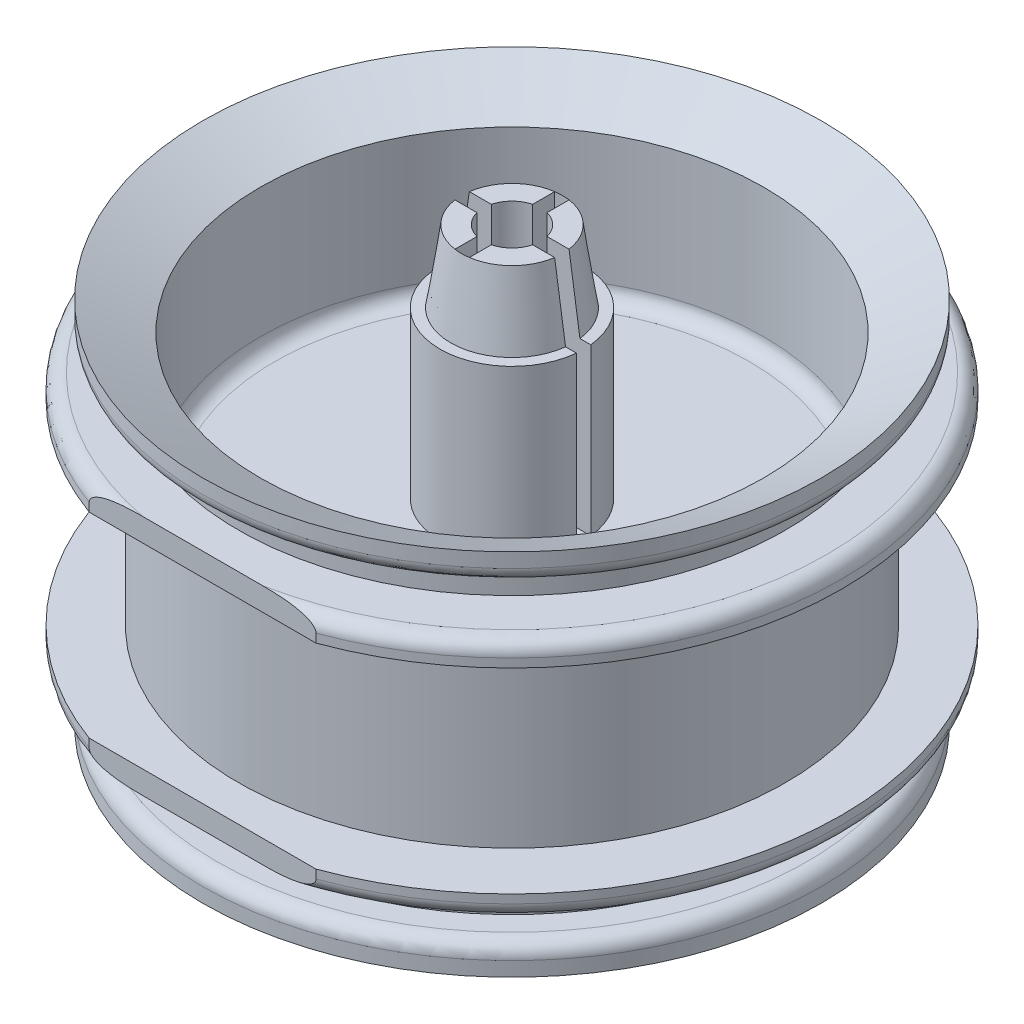
from build123d import *
from build123d.topology import SkipClean

# Parameters (mm, degrees)
SKETCH_1_R          = 19
EXTRUDE_1_DEPTH     = 25.6
SKETCH_6_R          = 17.5
CUT_EXTRUDE_1_DEPTH = 12
CUT_EXTRUDE_START   = -12
SKETCH_7_R          = 17.5
CUT_EXTRUDE_2_DEPTH = 12
SKETCH_9_R          = 3.5
EXTRUDE_2_DEPTH     = 2
SKETCH_10_R         = 5
EXTRUDE_3_DEPTH     = 11.5
CUT_EXTRUDE_3_DEPTH = 16.5
CUT_EXTRUDE_4_REACH = 46.213
SKETCH_13_W         = 10
SKETCH_13_H         = 1
CUT_EXTRUDE_START_2 = -3
SKETCH_14_R         = 2
CUT_EXTRUDE_5_DEPTH = 36.116007136
CUT_EXTRUDE_6_DEPTH = 3
CUT_EXTRUDE_START_3 = 21.5
SKETCH_16_W         = 48.533452519
SKETCH_16_H         = 19.302023182
CUT_EXTRUDE_7_DEPTH = 1.4
CUT_EXTRUDE_START_4 = -22.9
SKETCH_16_2_W       = 48.533452519
SKETCH_16_2_H       = 19.302023182
CUT_EXTRUDE_8_DEPTH = 1.4
SKETCH_17_R         = 2
CUT_EXTRUDE_9_DEPTH = 0.5
CHAMFER_1_SIZE      = 0.5
FILLET_1_R          = 1


# Read off the part's stored shape, not the designer's step: 切除-拉伸6
with BuildPart() as part:
    # 草图1 → 凸台-拉伸1 (new body)
    with BuildSketch(Plane(origin=(0, 0, 0), x_dir=(1, 0, 0), z_dir=(0, 1, 0))):
        with Locations(Location((0, 0, 0), (0, 0, 270))):
            Circle(SKETCH_1_R)
    extrude(amount=EXTRUDE_1_DEPTH)

    # 草图4 → 旋转1 (revolve)
    with BuildSketch(Plane.XY, mode=Mode.PRIVATE) as revolve_1_sk:
        with BuildLine():
            Line((21.5, 25.6), (21.5, 24.6))
            ThreePointArc((21.5, 24.6), (21.207106781, 23.892893219), (20.5, 23.6))
            Line((20.5, 23.6), (19, 23.6))
            Line((19, 23.6), (19, 25.6))
            Line((19, 25.6), (21.5, 25.6))
        make_face()
        with BuildLine():
            Line((21.5, 0), (21.5, 1))
            ThreePointArc((21.5, 1), (21.207106781, 1.707106781), (20.5, 2))
            Line((20.5, 2), (19, 2))
            Line((19, 2), (19, 0))
            Line((19, 0), (21.5, 0))
        make_face()
    revolve(revolve_1_sk.sketch.rotate(Axis((0, 0, 0), (0, 1, 0)), 90), axis=Axis((0, 0, 0), (0, 1, 0)))

    # 草图5 → 旋转2 (revolve)
    with BuildSketch(Plane.XY, mode=Mode.PRIVATE) as revolve_2_sk:
        with BuildLine():
            Line((22.9, 19.6), (22.9, 20.2))
            ThreePointArc((22.9, 20.2), (22.607106781, 20.907106781), (21.9, 21.2))
            Line((21.9, 21.2), (19, 21.2))
            Line((19, 21.2), (19, 19.6))
            Line((19, 19.6), (22.9, 19.6))
        make_face()
        with BuildLine():
            Line((19, 4.4), (19, 6))
            Line((19, 6), (22.9, 6))
            Line((22.9, 6), (22.9, 5.4))
            ThreePointArc((22.9, 5.4), (22.607106781, 4.692893219), (21.9, 4.4))
            Line((21.9, 4.4), (19, 4.4))
        make_face()
    revolve(revolve_2_sk.sketch.rotate(Axis((0, 0, 0), (0, 1, 0)), 90), axis=Axis((0, 0, 0), (0, 1, 0)))

    # 草图6 → 切除-拉伸1 (cut)
    with BuildSketch(Plane(origin=(0, 25.6, 0), x_dir=(1, 0, 0), z_dir=(0, 1, 0))):
        with Locations(Location((0, 0, 0), (0, 0, 270))):
            Circle(SKETCH_6_R)
    extrude(amount=-CUT_EXTRUDE_1_DEPTH, mode=Mode.SUBTRACT)

    # 草图7 → 切除-拉伸2 (cut)
    with BuildSketch(Plane.XZ.offset(CUT_EXTRUDE_START)):
        with Locations(Location((0, 0, 0), (0, 0, 90))):
            Circle(SKETCH_7_R)
    extrude(amount=CUT_EXTRUDE_2_DEPTH, mode=Mode.SUBTRACT)

    # 草图8 → 切除-旋转1 (revolve, cut)
    with BuildSketch(Plane.XY, mode=Mode.PRIVATE) as cut_revolve_1_sk:
        Polygon((0, 25.6), (0, 23.6), (17.5, 23.6), (21.5, 25.6), align=None)
        Polygon((17.5, 2), (21.5, 0), (0, 0), (0, 2), align=None)
    revolve(cut_revolve_1_sk.sketch.rotate(Axis((0, 0, 0), (0, 1, 0)), 90), axis=Axis((0, 0, 0), (0, 1, 0)), mode=Mode.SUBTRACT)

    # 草图9 → 凸台-拉伸2 (add)
    with BuildSketch(Plane(origin=(0, 12, 0), x_dir=(-1, 0, 0), z_dir=(0, -1, 0))):
        with Locations(Location((0, 0, 0), (0, 0, 90))):
            Circle(SKETCH_9_R)
    extrude(amount=EXTRUDE_2_DEPTH)

    # 草图10 → 凸台-拉伸3 (add)
    with BuildSketch(Plane(origin=(0, 13.6, 0), x_dir=(1, 0, 0), z_dir=(0, 1, 0))):
        with Locations(Location((0, 0, 0), (0, 0, 270))):
            Circle(SKETCH_10_R)
    extrude(amount=EXTRUDE_3_DEPTH)

    # 草图11 → 旋转3 (revolve)
    with BuildSketch(Plane.XY, mode=Mode.PRIVATE) as revolve_3_sk:
        Polygon((4.25, 25.1), (3.5, 30.1), (0, 30.1), (0, 25.1), align=None)
    revolve(revolve_3_sk.sketch.rotate(Axis((0, 30.1, 0), (0, -1, 0)), 270), axis=Axis((0, 30.1, 0), (0, -1, 0)))

    # 草图12 → 切除-拉伸3 (cut)
    with BuildSketch(Plane(origin=(0, 30.1, 0), x_dir=(1, 0, 0), z_dir=(0, 1, 0))):
        with BuildLine():
            Line((-0.5, -1.936491673), (-0.5, -3.464101615))
            ThreePointArc((-0.5, -3.464101615), (0, -3.5), (0.5, -3.464101615))
            Line((0.5, -3.464101615), (0.5, -1.936491673))
            ThreePointArc((0.5, -1.936491673), (2, 0), (0.5, 1.936491673))
            Line((0.5, 1.936491673), (0.5, 3.464101615))
            ThreePointArc((0.5, 3.464101615), (0, 3.5), (-0.5, 3.464101615))
            Line((-0.5, 3.464101615), (-0.5, 1.936491673))
            ThreePointArc((-0.5, 1.936491673), (-2, 0), (-0.5, -1.936491673))
        make_face()
    extrude(amount=-CUT_EXTRUDE_3_DEPTH, mode=Mode.SUBTRACT)

    # 切除-拉伸4: up to this face of the body (flat: up to its plane)
    cut_extrude_4_end = Plane(part.part.faces().sort_by_distance((0, 13.6, -17.005025253))[0])
    # 草图13 → 切除-拉伸4 (cut, up to the picked face)
    with BuildSketch(Plane(origin=(0, 30.1, 0), x_dir=(1, 0, 0), z_dir=(0, 1, 0)), mode=Mode.PRIVATE) as cut_extrude_4_sk1:
        Rectangle(SKETCH_13_W, SKETCH_13_H)
    cut_extrude_4_tool1 = split(extrude(cut_extrude_4_sk1.sketch, amount=-CUT_EXTRUDE_4_REACH, mode=Mode.PRIVATE), bisect_by=cut_extrude_4_end, keep=Keep.BOTH, mode=Mode.PRIVATE)
    add(cut_extrude_4_tool1.solids().sort_by(Axis((0, 30.1, 0), (0, -1, 0)))[0], mode=Mode.SUBTRACT)

    # 草图14 → 切除-拉伸5 (cut, through all)
    with BuildSketch(Plane(origin=(0, 10, 0), x_dir=(-1, 0, 0), z_dir=(0, -1, 0)).offset(CUT_EXTRUDE_START_2)):
        with Locations(Location((0, 0, 0), (0, 0, 255.522487814))):
            Circle(SKETCH_14_R)
    extrude(amount=-CUT_EXTRUDE_5_DEPTH, mode=Mode.SUBTRACT)

    # 切除-拉伸6 outline → 切除-拉伸6 (cut)
    with BuildSketch(Plane(origin=(0, 10, 0), x_dir=(-1, 0, 0), z_dir=(0, -1, 0)).offset(CUT_EXTRUDE_START_2)):
        with BuildLine():
            Line((1.25, -1.5612495), (1.25, 1.5612495))
            ThreePointArc((1.25, 1.5612495), (0, 2), (-1.25, 1.5612495))
            Line((-1.25, 1.5612495), (-1.25, -1.5612495))
            ThreePointArc((-1.25, -1.5612495), (0, -2), (1.25, -1.5612495))
        make_face()
    extrude(amount=CUT_EXTRUDE_6_DEPTH, mode=Mode.SUBTRACT)

    # 草图16 → 切除-拉伸7 (cut)
    with BuildSketch(Plane.XY.offset(CUT_EXTRUDE_START_3)):
        with Locations((0.185596376, 12.869242573)):
            Rectangle(SKETCH_16_W, SKETCH_16_H)
    extrude(amount=CUT_EXTRUDE_7_DEPTH, mode=Mode.SUBTRACT)

    # 草图16<2> → 切除-拉伸8 (cut)
    with BuildSketch(Plane.XY.offset(CUT_EXTRUDE_START_4)):
        with Locations((0.185596376, 12.869242573)):
            Rectangle(SKETCH_16_2_W, SKETCH_16_2_H)
    extrude(amount=CUT_EXTRUDE_8_DEPTH, mode=Mode.SUBTRACT)

    # 草图17 → 切除-拉伸9 (cut)
    with SkipClean():  # the faces are left unmerged after this step: merging them gives an invalid solid
        with BuildSketch(Plane(origin=(0, 10, 0), x_dir=(-1, 0, 0), z_dir=(0, -1, 0))):
            with Locations(Location((0, 0, 0), (0, 0, 255.522487814))):
                Circle(SKETCH_17_R)
        extrude(amount=-CUT_EXTRUDE_9_DEPTH, mode=Mode.SUBTRACT)

    # 倒角1
    chamfer_1_edges = [part.edges().sort_by_distance(p)[0] for p in [
        (0, 10, -2),
    ]]
    chamfer(chamfer_1_edges, length=CHAMFER_1_SIZE - 0.0001)  # a hair under: the kernel refuses the full size

    # 圆角1
    fillet_1_edges = [part.edges().sort_by_distance(p)[0] for p in [
        (0, 13.6, -17.5),
        (0, 12, -17.5),
    ]]
    fillet(fillet_1_edges, radius=FILLET_1_R)


solid = part.part
